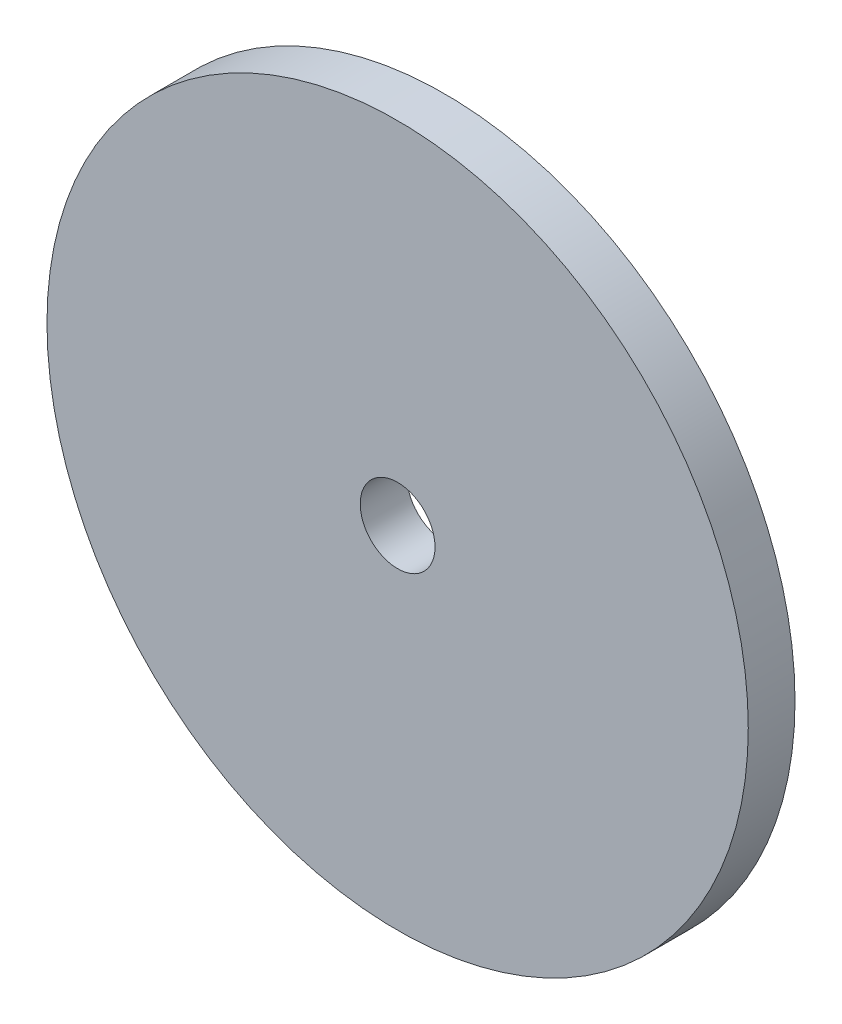
from build123d import *

# Parameters (mm, degrees)
SKETCH1_R           = 75
SKETCH1_R_2         = 8
BOSS_EXTRUDE1_DEPTH = 10


with BuildPart() as part:
    # Sketch1 → Boss-Extrude1 (new body)
    with BuildSketch(Plane.XY):
        Circle(SKETCH1_R)
        Circle(SKETCH1_R_2, mode=Mode.SUBTRACT)
    extrude(amount=BOSS_EXTRUDE1_DEPTH)


solid = part.part
